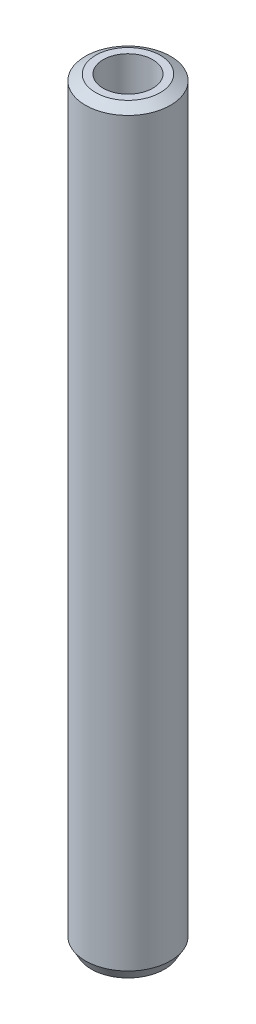
from build123d import *
from OCP.BRepFilletAPI import BRepFilletAPI_MakeChamfer

# Parameters (mm, degrees)
SKETCH1_R           = 10
BOSS_EXTRUDE1_DEPTH = 177.953678125
SKETCH2_R           = 5.826087102
CUT_EXTRUDE1_DEPTH  = 179.51473765
CHAMFER1_SIZE       = 1.382524347
CHAMFER1_SIZE2      = 2.394602412


with BuildPart() as part:
    # Sketch1 → Boss-Extrude1 (new body)
    with BuildSketch(Plane(origin=(0, 0, 0), x_dir=(1, 0, 0), z_dir=(0, 1, 0))):
        Circle(SKETCH1_R)
    extrude(amount=BOSS_EXTRUDE1_DEPTH)

    # Sketch2 → Cut-Extrude1 (cut, through all)
    with BuildSketch(Plane(origin=(0, 0, 0), x_dir=(1, 0, 0), z_dir=(0, 1, 0))):
        Circle(SKETCH2_R)
    extrude(amount=CUT_EXTRUDE1_DEPTH, mode=Mode.SUBTRACT)

    # Chamfer1: one chamfer whose edges measure the first distance from different faces: ONE call of the kernel's chamfer builder (chamfer() names one face for all edges)
    chamfer1_edges_1 = [part.edges().sort_by_distance(p)[0] for p in [
        (-10, 177.953678125, 0),
    ]]
    chamfer1_side_1 = [part.faces().sort_by_distance(p)[0] for p in [
        (-10, 88.976839063, 0),
    ]]
    chamfer1_edges_2 = [part.edges().sort_by_distance(p)[0] for p in [
        (-10, 0, 0),
    ]]
    chamfer1_side_2 = [part.faces().sort_by_distance(p)[0] for p in [
        (-9.717157288, 0, 0),
    ]]
    chamfer1 = BRepFilletAPI_MakeChamfer(part.part.solid().wrapped)
    for e in chamfer1_edges_1:
        chamfer1.Add(CHAMFER1_SIZE, CHAMFER1_SIZE2, e.wrapped, chamfer1_side_1[0].wrapped)  # the first distance lies on this face
    for e in chamfer1_edges_2:
        chamfer1.Add(CHAMFER1_SIZE, CHAMFER1_SIZE2, e.wrapped, chamfer1_side_2[0].wrapped)  # the first distance lies on this face
    add(Compound.cast(chamfer1.Shape()), mode=Mode.REPLACE)


solid = part.part
